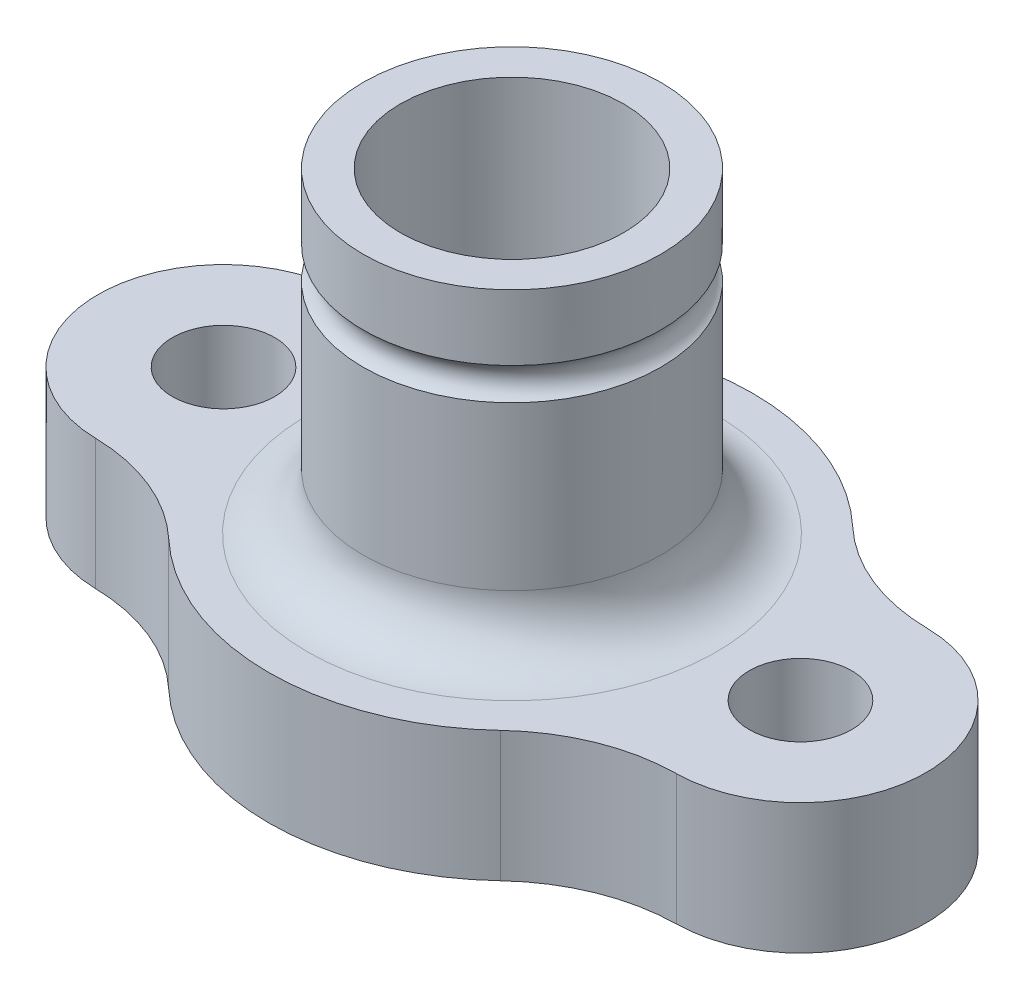
from build123d import *

# Parameters (mm, degrees)
SKETCH1_R           = 7
SKETCH1_R_2         = 2.75
BOSS_EXTRUDE1_DEPTH = 7
SKETCH2_R           = 8
SKETCH2_R_2         = 6
BOSS_EXTRUDE2_DEPTH = 17
FILLET1_R           = 3
FILLET2_R           = 3
SKETCH3_R           = 1


with BuildPart() as part:
    # Sketch1 → Boss-Extrude1 (new body)
    with BuildSketch(Plane(origin=(0, 0, 0), x_dir=(1, 0, 0), z_dir=(0, 1, 0))):
        with BuildLine():
            ThreePointArc((-15.634333704, 6.748663161), (-22.25, 0), (-15.634333704, -6.748663161))
            ThreePointArc((-15.634333704, -6.748663161), (-12.054001616, -7.488359295), (-8.978814065, -9.465516285))
            ThreePointArc((-8.978814065, -9.465516285), (-0.068820662, -12.999999969), (8.841661443, -9.466748488))
            ThreePointArc((8.841661443, -9.466748488), (11.954703039, -7.474770851), (15.578657445, -6.749541689))
            ThreePointArc((15.578657445, -6.749541689), (22.25, 0), (15.578657445, 6.749541689))
            ThreePointArc((15.578657445, 6.749541689), (11.954703039, 7.474770851), (8.841661443, 9.466748488))
            ThreePointArc((8.841661443, 9.466748488), (-0.068820662, 12.999999969), (-8.978814065, 9.465516285))
            ThreePointArc((-8.978814065, 9.465516285), (-12.054001616, 7.488359295), (-15.634333704, 6.748663161))
        make_face()
        with Locations(Location((0, 0, 0), (0, 0, 270))):
            Circle(SKETCH1_R, mode=Mode.SUBTRACT)
        with Locations(Location((-15.5, 0, 0), (0, 0, 270))):
            Circle(SKETCH1_R_2, mode=Mode.SUBTRACT)
        with Locations(Location((15.5, 0, 0), (0, 0, 270))):
            Circle(SKETCH1_R_2, mode=Mode.SUBTRACT)
    extrude(amount=BOSS_EXTRUDE1_DEPTH)

    # Sketch2 → Boss-Extrude2 (add)
    with BuildSketch(Plane(origin=(0, 7, 0), x_dir=(1, 0, 0), z_dir=(0, 1, 0))):
        with Locations(Location((0, 0, 0), (0, 0, 270))):
            Circle(SKETCH2_R)
        with Locations(Location((0, 0, 0), (0, 0, 270))):
            Circle(SKETCH2_R_2, mode=Mode.SUBTRACT)
    extrude(amount=BOSS_EXTRUDE2_DEPTH)

    # Fillet1
    # the kernel refuses this fillet: 3 mm, written as the material it adds along each edge
    with BuildSketch(Plane(origin=(0, 7, 0), x_dir=(0, 0, 1), z_dir=(-1, 0, 0))) as fillet1_piece_1:
        with BuildLine():
            CenterArc((4, -2.236067977), FILLET1_R, 0, 48.189685104)
            Line((6, 0), (6.04, 0.04472136))
            ThreePointArc((6.04, 0.04472136), (6.5, 0.06), (7, 0.06))
            Line((7, 0.06), (7.06, 0))
            Line((7.06, 0), (7.06, -2.236067977))
            Line((7.06, -2.236067977), (7, -2.236067977))
        make_face()
    revolve(axis=Axis((0, 7, 0), (0, 1, 0)))
    with BuildSketch(Plane(origin=(0, 7, 0), x_dir=(0, 0, 1), z_dir=(-1, 0, 0))) as fillet1_piece_2:
        with BuildLine():
            CenterArc((8 + FILLET1_R, FILLET1_R), FILLET1_R, 180, 90)
            Line((8, FILLET1_R), (8 - FILLET1_R * 0.02, FILLET1_R))
            Line((8 - FILLET1_R * 0.02, FILLET1_R), (8 - FILLET1_R * 0.02, -FILLET1_R * 0.02))
            Line((8 - FILLET1_R * 0.02, -FILLET1_R * 0.02), (8 + FILLET1_R, -FILLET1_R * 0.02))
            Line((8 + FILLET1_R, -FILLET1_R * 0.02), (8 + FILLET1_R, 0))
        make_face()
    revolve(axis=Axis((0, 7, 0), (0, 1, 0)))

    # Fillet2
    fillet2_edges = [part.edges().sort_by_distance(p)[0] for p in [
        (0, 7, -6),
    ]]
    fillet(fillet2_edges, radius=FILLET2_R)


with BuildPart() as body_2:
    # Sketch3 → Revolve1 (revolve)
    with BuildSketch(Plane(origin=(0, 0, 0), x_dir=(0, 0, -1), z_dir=(1, 0, 0))):
        with Locations((8.5, 19.608844607)):
            Circle(SKETCH3_R)
    revolve(axis=Axis((0, 0, 0), (0, 1, 0)))


with BuildPart() as part_1:
    add(part.part)

    # Intersect1: read off the stored shape, not the designer's step
    # Intersect1: cut body 2
    add(body_2.part, mode=Mode.SUBTRACT)


solid = part_1.part
